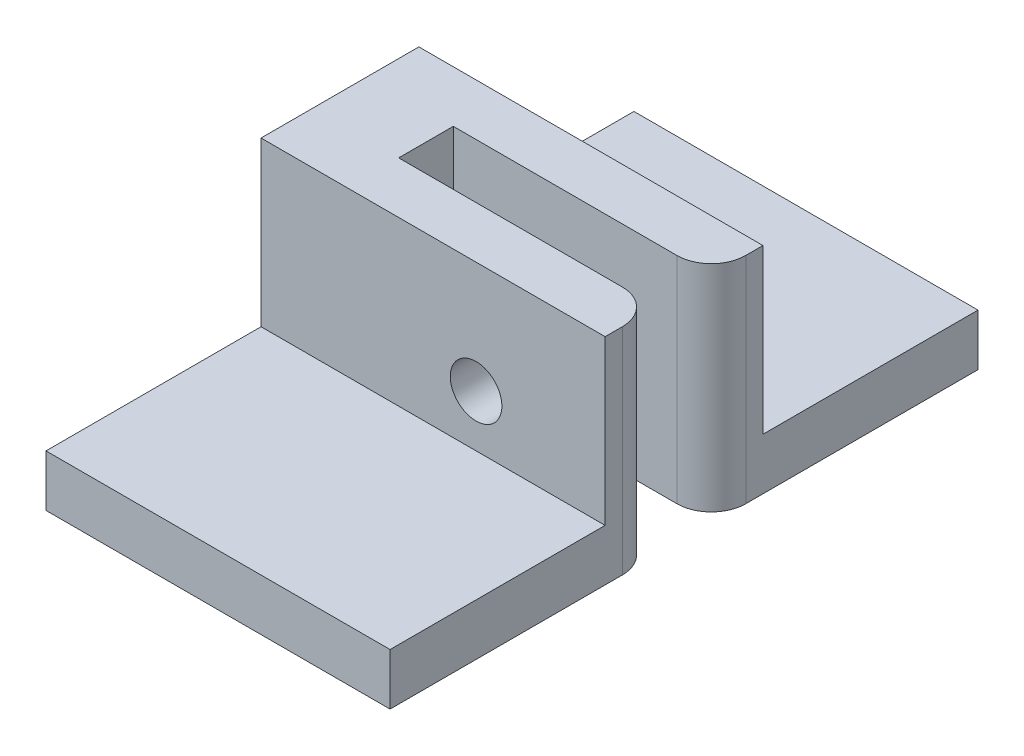
from build123d import *

# Parameters (mm, degrees)
BOSS_EXTRUDE1_DEPTH = 20
SKETCH2_W           = 3.175
SKETCH2_H           = 12.5
CUT_EXTRUDE1_DEPTH  = 15
SKETCH3_R           = 1.5
CUT_EXTRUDE2_DEPTH  = 33.032103037
FILLET1_R           = 2


with BuildPart() as part:
    # Sketch1 → Boss-Extrude1 (new body)
    with BuildSketch(Plane(origin=(0, 0, 0), x_dir=(0, 0, -1), z_dir=(1, 0, 0))):
        Polygon((0, 12.5), (3, 12.5), (3, 3), (15.5, 3), (15.5, 0), (0, 0), (-3.175, 0), (-18.675, 0), (-18.675, 3), (-6.175, 3), (-6.175, 12.5), (-3.175, 12.5), align=None)
    extrude(amount=BOSS_EXTRUDE1_DEPTH)

    # Sketch2 → Cut-Extrude1 (cut)
    with BuildSketch(Plane(origin=(20, 0, 0), x_dir=(0, 0, -1), z_dir=(1, 0, 0))):
        with Locations((-1.5875, 6.25)):
            Rectangle(SKETCH2_W, SKETCH2_H)
    extrude(amount=-CUT_EXTRUDE1_DEPTH, mode=Mode.SUBTRACT)

    # Sketch3 → Cut-Extrude2 (cut, through all)
    with BuildSketch(Plane.XY.offset(6.175)):
        with Locations((12.5, 6)):
            Circle(SKETCH3_R)
    extrude(amount=-CUT_EXTRUDE2_DEPTH, mode=Mode.SUBTRACT)

    # Fillet1
    fillet1_edges = [part.edges().sort_by_distance(p)[0] for p in [
        (20, 6.25, 3.175),
        (20, 6.25, 0),
    ]]
    fillet(fillet1_edges, radius=FILLET1_R)


solid = part.part
